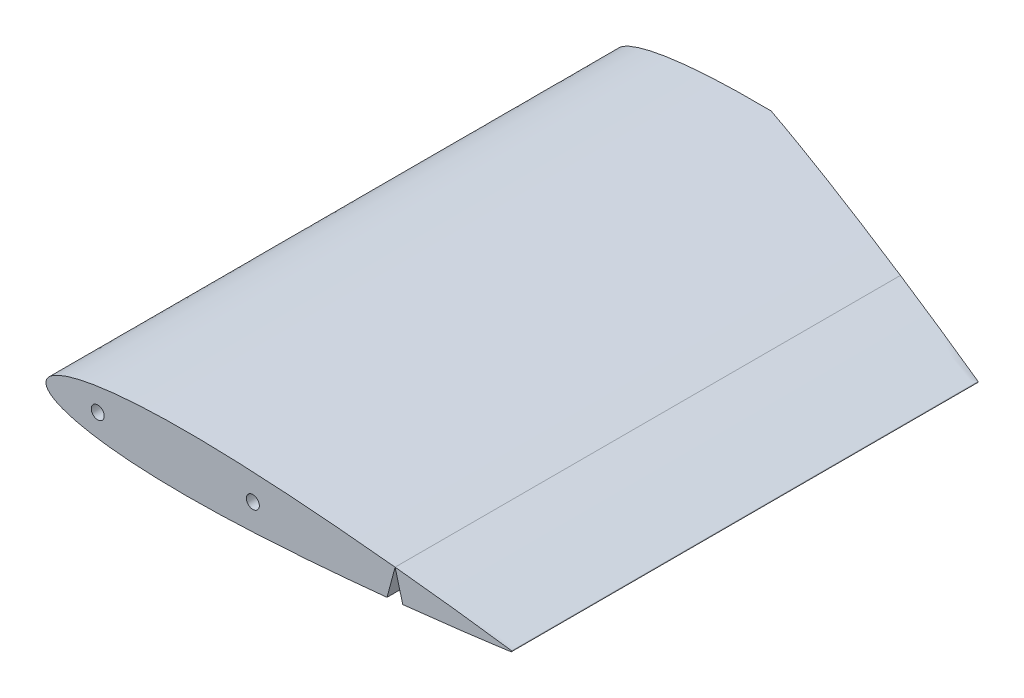
from build123d import *

# Parameters (mm, degrees)
BOSS_EXTRUDE1_DEPTH            = 279.908
SKETCH2_R                      = 3.175
CUT_EXTRUDE1_DEPTH             = 362.655195658
CUT_EXTRUDE2_REACH             = 363.655
CUT_EXTRUDE2_DIRECTION_2_REACH = 363.655
CUT_EXTRUDE4_REACH             = 363.655
SKETCH5_R                      = 3.175
CUT_EXTRUDE5_DEPTH             = 362.655195658


with BuildPart() as part:
    # Sketch1 → Boss-Extrude1 (new body)
    with BuildSketch(Plane.XY):
        with BuildLine():
            add(Edge.make_bspline(
                [(0, 0), (0, -0.328477994), (0.094132544, -1.002317273), (0.516328799, -1.979047664), (1.206253084, -2.919084286), (2.155530292, -3.826507135), (3.361088978, -4.704503454), (4.821173785, -5.55391213), (6.533647864, -6.373768076), (8.495474965, -7.162212853), (10.702763054, -7.916899641), (13.150800968, -8.635300083), (15.834201004, -9.314707599), (18.746872001, -9.952655748), (21.882185807, -10.546523838), (25.23289446, -11.094151144), (28.791264659, -11.593290214), (32.549019843, -12.042255982), (36.4974269, -12.43944474), (40.627278951, -12.783751315), (44.928952977, -13.074379275), (49.392427762, -13.310840666), (54.00728167, -13.493188322), (58.76274015, -13.621763124), (63.647705329, -13.697267659), (68.650780173, -13.72087076), (73.760279514, -13.693983832), (78.964273059, -13.618365131), (84.250609651, -13.496063622), (89.606956912, -13.329404125), (95.020804226, -13.120820839), (100.479505937, -12.87299727), (105.970317865, -12.588746266), (111.480424999, -12.270931467), (116.996960654, -11.922505449), (122.507041698, -11.546430916), (127.997806048, -11.145660598), (133.456428211, -10.723198576), (138.870163217, -10.281871752), (144.226358514, -9.824563044), (149.512524459, -9.354044127), (154.7162998, -8.873020616), (159.825543847, -8.384191905), (164.828306858, -7.890045542), (169.712928008, -7.393148198), (174.467978148, -6.895915808), (179.082363681, -6.400793333), (183.545298009, -5.91018943), (187.846354056, -5.426302321), (191.975503597, -4.951590796), (195.923094736, -4.488262398), (199.679907253, -4.038593513), (203.237156328, -3.604799783), (206.586548753, -3.189155079), (209.720252989, -2.793754916), (212.630956022, -2.420810863), (215.311847817, -2.072241054), (217.75667572, -1.750168635), (219.959752272, -1.4563836), (221.915845594, -1.192545194), (223.620666071, -0.960790622), (225.069395854, -0.760875596), (226.261037983, -0.598983787), (227.186433997, -0.462932704), (227.858906671, -0.385743815), (228.245225393, -0.302214543), (228.641481893, -0.309763383), (228.641481893, 0.309763383), (228.245225393, 0.302214543), (227.858906671, 0.385743815), (227.186433997, 0.462932704), (226.261037983, 0.598983787), (225.069395854, 0.760875596), (223.620666071, 0.960790622), (221.915845594, 1.192545194), (219.959752272, 1.4563836), (217.75667572, 1.750168635), (215.311847817, 2.072241054), (212.630956022, 2.420810863), (209.720252989, 2.793754916), (206.586548753, 3.189155079), (203.237156328, 3.604799783), (199.679907253, 4.038593513), (195.923094736, 4.488262398), (191.975503597, 4.951590796), (187.846354056, 5.426302321), (183.545298009, 5.91018943), (179.082363681, 6.400793333), (174.467978148, 6.895915808), (169.712928008, 7.393148198), (164.828306858, 7.890045542), (159.825543847, 8.384191905), (154.7162998, 8.873020616), (149.512524459, 9.354044127), (144.226358514, 9.824563044), (138.870163217, 10.281871752), (133.456428211, 10.723198576), (127.997806048, 11.145660598), (122.507041698, 11.546430916), (116.996960654, 11.922505449), (111.480424999, 12.270931467), (105.970317865, 12.588746266), (100.479505937, 12.87299727), (95.020804226, 13.120820839), (89.606956912, 13.329404125), (84.250609651, 13.496063622), (78.964273059, 13.618365131), (73.760279514, 13.693983832), (68.650780173, 13.72087076), (63.647705329, 13.697267659), (58.76274015, 13.621763124), (54.00728167, 13.493188322), (49.392427762, 13.310840666), (44.928952977, 13.074379275), (40.627278951, 12.783751315), (36.4974269, 12.43944474), (32.549019843, 12.042255982), (28.791264659, 11.593290214), (25.23289446, 11.094151144), (21.882185807, 10.546523838), (18.746872001, 9.952655748), (15.834201004, 9.314707599), (13.150800968, 8.635300083), (10.702763054, 7.916899641), (8.495474965, 7.162212853), (6.533647864, 6.373768076), (4.821173785, 5.55391213), (3.361088978, 4.704503454), (2.155530292, 3.826507135), (1.206253084, 2.919084286), (0.516328799, 1.979047664), (0.094132544, 1.002317273), (0, 0.328477994), (0, 0)],
                knots=[0, 0, 0, 0, 0.002106168, 0.00432059, 0.006772783, 0.009556697, 0.012734041, 0.016342888, 0.020405604, 0.024934102, 0.029933071, 0.035402241, 0.04133743, 0.04773159, 0.054575389, 0.061857405, 0.069564571, 0.077682311, 0.086194684, 0.095084441, 0.104333244, 0.1139217, 0.123829339, 0.134034708, 0.144515531, 0.155248716, 0.166210356, 0.177375783, 0.188719821, 0.200216647, 0.211839951, 0.223562989, 0.235358653, 0.247199625, 0.259058395, 0.270907226, 0.282718457, 0.294464514, 0.306117689, 0.317650771, 0.329036618, 0.34024851, 0.351259999, 0.362045273, 0.372578891, 0.382836142, 0.392792739, 0.40242532, 0.411711115, 0.420628244, 0.429155673, 0.437273179, 0.444961561, 0.452202575, 0.458979063, 0.465274876, 0.471074963, 0.476365569, 0.481133961, 0.485368768, 0.489059784, 0.492198148, 0.494776266, 0.49678801, 0.498228425, 0.499094073, 0.499382862, 0.500617138, 0.500905927, 0.501771575, 0.50321199, 0.505223734, 0.507801852, 0.510940216, 0.514631232, 0.518866039, 0.523634431, 0.528925037, 0.534725124, 0.541020937, 0.547797425, 0.555038439, 0.562726821, 0.570844327, 0.579371756, 0.588288885, 0.59757468, 0.607207261, 0.617163858, 0.627421109, 0.637954727, 0.648740001, 0.65975149, 0.670963382, 0.682349229, 0.693882311, 0.705535486, 0.717281543, 0.729092774, 0.740941605, 0.752800375, 0.764641347, 0.776437011, 0.788160049, 0.799783353, 0.811280179, 0.822624217, 0.833789644, 0.844751284, 0.855484469, 0.865965292, 0.876170661, 0.8860783, 0.895666756, 0.904915559, 0.913805316, 0.922317689, 0.930435429, 0.938142595, 0.945424611, 0.95226841, 0.95866257, 0.964597759, 0.970066929, 0.975065898, 0.979594396, 0.983657112, 0.987265959, 0.990443303, 0.993227217, 0.99567941, 0.997893832, 1, 1, 1, 1], degree=3))
        make_face()
    extrude(amount=BOSS_EXTRUDE1_DEPTH)

    # Sketch2 → Cut-Extrude1 (cut, through all)
    with BuildSketch(Plane(origin=(0, 0, 0), x_dir=(-1, 0, 0), z_dir=(0, 0, -1))):
        with Locations((-25.4, 0)):
            Circle(SKETCH2_R)
    extrude(amount=-CUT_EXTRUDE1_DEPTH, mode=Mode.SUBTRACT)

    # Sketch3 → Cut-Extrude2 (cut, up to next)
    with BuildSketch(Plane(origin=(0, 0, 0), x_dir=(1, 0, 0), z_dir=(0, 1, 0)), mode=Mode.PRIVATE) as cut_extrude2_sk1:
        Polygon((228.654985762, 0), (228.6, -50.8), (76.2, 0), align=None)
    cut_extrude2_tool1 = extrude(cut_extrude2_sk1.sketch, amount=-CUT_EXTRUDE2_REACH, mode=Mode.PRIVATE) & part.part
    add(cut_extrude2_tool1.solids().sort_by_distance((177.818329, 0, 16.933333))[0], mode=Mode.SUBTRACT)

    # Sketch3 → Cut-Extrude2 direction 2 (cut, up to next)
    with BuildSketch(Plane(origin=(0, 0, 0), x_dir=(1, 0, 0), z_dir=(0, 1, 0)), mode=Mode.PRIVATE) as cut_extrude2_direction_2_sk1:
        Polygon((228.654985762, 0), (228.6, -50.8), (76.2, 0), align=None)
    cut_extrude2_direction_2_tool1 = extrude(cut_extrude2_direction_2_sk1.sketch, amount=CUT_EXTRUDE2_DIRECTION_2_REACH, mode=Mode.PRIVATE) & part.part
    add(cut_extrude2_direction_2_tool1.solids().sort_by_distance((177.818329, 0, 16.933333))[0], mode=Mode.SUBTRACT)

    # Cut-Extrude4: up to this plane
    cut_extrude4_end = Plane(origin=(228.6, 13.72187076, 50.8), z_dir=(0.3162277660168379, 0, -0.9486832980505139))
    # Sketch4 → Cut-Extrude4 (cut, up to the surface)
    with BuildSketch(Plane.XY.offset(279.908), mode=Mode.PRIVATE) as cut_extrude4_sk1:
        with BuildLine():
            Line((171.45, 7.210810422), (167.476069754, -7.620099162))
            ThreePointArc((167.476069754, -7.620099162), (171.418734468, -7.953217945), (175.208259831, -6.815206213))
            Line((175.208259831, -6.815206213), (171.45, 7.210810422))
        make_face()
    cut_extrude4_tool1 = split(extrude(cut_extrude4_sk1.sketch, amount=-CUT_EXTRUDE4_REACH, mode=Mode.PRIVATE), bisect_by=cut_extrude4_end, keep=Keep.BOTH, mode=Mode.PRIVATE)
    add(cut_extrude4_tool1.solids().sort_by_distance((171.377772, -2.738805, 279.908))[0], mode=Mode.SUBTRACT)


with BuildPart() as cut_extrude4_piece_1:
    # of the separate pieces the step leaves, piece 1, a body of its own (cut_extrude4_pieces)
    add(part.part.solids().sort_by_distance((0, 0, 0))[0])

    # Sketch5 → Cut-Extrude5 (cut, through all)
    with BuildSketch(Plane(origin=(0, 0, 0), x_dir=(-1, 0, 0), z_dir=(0, 0, -1))):
        with Locations((-101.6, 0)):
            Circle(SKETCH5_R)
    extrude(amount=-CUT_EXTRUDE5_DEPTH, mode=Mode.SUBTRACT)


with BuildPart() as cut_extrude4_piece_2:
    # of the separate pieces the step leaves, piece 2, a body of its own (cut_extrude4_pieces)
    add(part.part.solids().sort_by_distance((175.208259831, -6.815206213, 279.908))[0])


solid = Compound([cut_extrude4_piece_1.part, cut_extrude4_piece_2.part])
